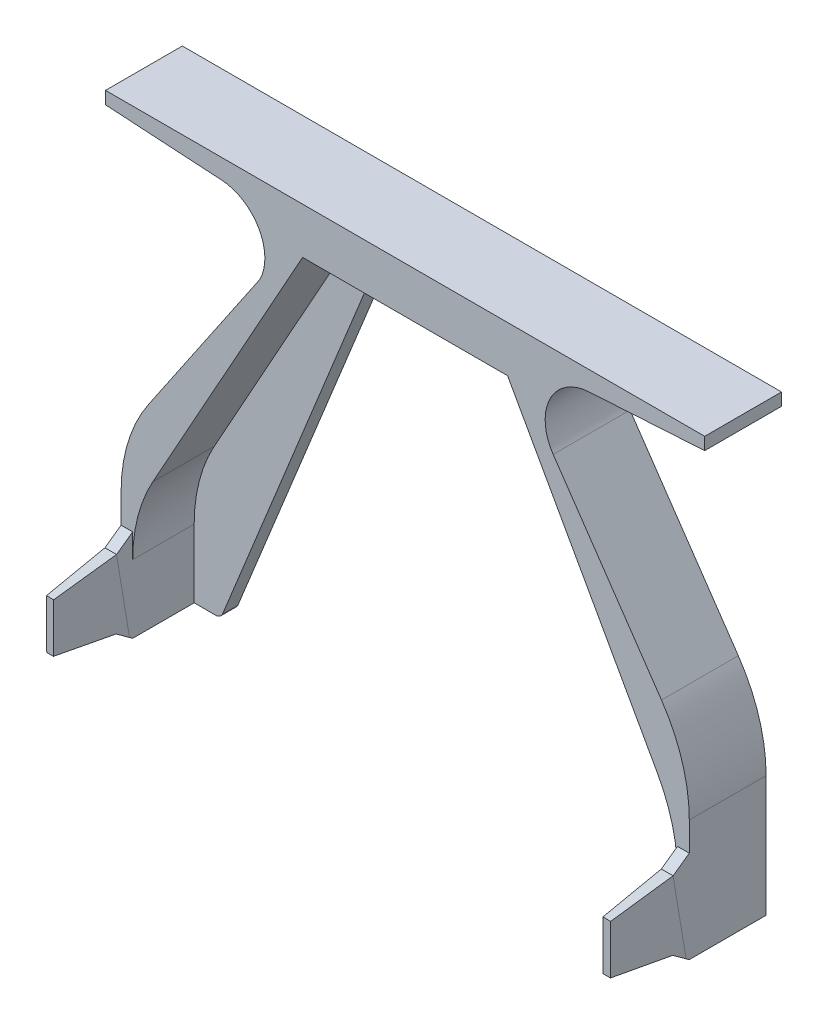
from build123d import *

# Parameters (mm, degrees)
SKETCH_1_W               = 47
SKETCH_1_H               = 32
EXTRUDE_1_DEPTH          = 5
CUT_EXTRUDE_1_DEPTH      = 58.078892771
CUT_EXTRUDE_5_DEPTH      = 4
CUT_EXTRUDE_6_DEPTH      = 58.078892771
SKETCH_5_W               = 0.757642216
SKETCH_5_H               = 6
SKETCH_5_W_2             = 0.766357784
EXTRUDE_2_DEPTH          = 5
CUT_EXTRUDE_7_DEPTH      = 54.728894948
CUT_EXTRUDE_8_DEPTH      = 55.418489547
SKETCH_8_W               = 47
SKETCH_8_H               = 2
CUT_EXTRUDE_9_DEPTH      = 10
CUT_EXTRUDE_START        = -0.814789408
CUT_EXTRUDE_10_OUTLINE_W = 4.001231447
CUT_EXTRUDE_10_OUTLINE_H = 5
CUT_EXTRUDE_10_DEPTH     = 0.814789408


# Read off the part's stored shape, not the designer's step: 切除-拉伸10
with BuildPart() as part:
    # 草图1 → 凸台-拉伸1 (new body)
    with BuildSketch(Plane.XY):
        with Locations((23.5, 16)):
            Rectangle(SKETCH_1_W, SKETCH_1_H)
    extrude(amount=EXTRUDE_1_DEPTH)

    # 草图2 → 切除-拉伸1 (cut, through all)
    with BuildSketch(Plane.XY.offset(5)):
        with BuildLine():
            Line((23.5, 0), (23.5, 26))
            Line((23.5, 26), (18.566996488, 26))
            ThreePointArc((18.566996488, 26), (18.15387041, 25.873934732), (17.881511675, 25.538694031))
            Line((17.881511675, 25.538694031), (7.626711155, 0.31171158))
            ThreePointArc((7.626711155, 0.31171158), (7.442674144, 0.085184252), (7.163518462, 0))
            Line((7.163518462, 0), (7.5, 0))
            Line((7.5, 0), (23.5, 0))
        make_face()
        with BuildLine():
            Line((28.45115486, 26), (23.5, 26))
            Line((23.5, 26), (23.5, 0))
            Line((23.5, 0), (39.5, 0))
            Line((39.5, 0), (39.836703186, 0))
            ThreePointArc((39.836703186, 0), (39.557420976, 0.085269428), (39.373395704, 0.311994211))
            Line((39.373395704, 0.311994211), (29.136809551, 25.538275761))
            ThreePointArc((29.136809551, 25.538275761), (28.864468188, 25.873808678), (28.45115486, 26))
        make_face()
    extrude(amount=-CUT_EXTRUDE_1_DEPTH, mode=Mode.SUBTRACT)

    # 草图3 → 切除-拉伸5 (cut)
    with BuildSketch(Plane.XY.offset(5)):
        with BuildLine():
            Line((28.45115486, 26), (18.566996488, 26))
            add(Edge.make_bspline(
                [(18.566996488, 26), (18.083486738, 25.978522449), (17.881511675, 25.538694031)],
                knots=[0, 0, 0, 1, 1, 1], degree=2))
            Line((17.881511675, 25.538694031), (7.614040039, 0.280540422))
            ThreePointArc((7.614040039, 0.280540422), (7.448406729, 0.076665827), (7.197166615, 0))
            Line((7.197166615, 0), (5.772, 0))
            Line((5.772, 0), (5.772, 4.436119664))
            ThreePointArc((5.772, 4.436119664), (6.104843669, 7.043618399), (7.082028835, 9.483893735))
            Line((7.082028835, 9.483893735), (16.830389156, 27))
            Line((16.830389156, 27), (30.169610844, 27))
            Line((30.169610844, 27), (39.917971165, 9.483893735))
            ThreePointArc((39.917971165, 9.483893735), (40.895156331, 7.043618399), (41.228, 4.436119664))
            Line((41.228, 4.436119664), (41.228, 0))
            Line((41.228, 0), (39.803032868, 0))
            ThreePointArc((39.803032868, 0), (39.551678879, 0.076742485), (39.386056133, 0.28079479))
            Line((39.386056133, 0.28079479), (29.136809551, 25.538275761))
            add(Edge.make_bspline(
                [(28.45115486, 26), (28.93495417, 25.978479476), (29.136809551, 25.538275761)],
                knots=[0, 0, 0, 1, 1, 1], degree=2))
        make_face()
    extrude(amount=-CUT_EXTRUDE_5_DEPTH, mode=Mode.SUBTRACT)

    # 草图4 → 切除-拉伸6 (cut, through all)
    with BuildSketch(Plane.XY.offset(5)):
        with BuildLine():
            Line((0, 0), (5.014357784, 0))
            Line((5.014357784, 0), (5.014357784, 7.877425761))
            ThreePointArc((5.014357784, 7.877425761), (5.475718856, 10.937654809), (6.818789734, 13.72584714))
            Line((6.818789734, 13.72584714), (14.045555305, 24.365213617))
            ThreePointArc((14.045555305, 24.365213617), (13.978253194, 27.216535436), (11.556446219, 28.722993754))
            Line((11.556446219, 28.722993754), (0, 29.43))
            Line((0, 29.43), (0, 0))
        make_face()
        with BuildLine():
            Line((41.994357784, 7.873314412), (41.994357784, 0))
            Line((41.994357784, 0), (47, 0))
            Line((47, 0), (47, 29.43))
            Line((47, 29.43), (35.433873083, 28.73462187))
            ThreePointArc((35.433873083, 28.73462187), (32.920113477, 27.060422918), (33.13664909, 24.047941912))
            Line((33.13664909, 24.047941912), (40.185693822, 13.727936391))
            ThreePointArc((40.185693822, 13.727936391), (41.531889434, 10.937130001), (41.994357784, 7.873314412))
        make_face()
    extrude(amount=-CUT_EXTRUDE_6_DEPTH, mode=Mode.SUBTRACT)

    # 草图5 → 凸台-拉伸2 (add)
    with BuildSketch(Plane.XY.offset(5)):
        with Locations((5.393178892, 3)):
            Rectangle(SKETCH_5_W, SKETCH_5_H)
        with Locations((41.611178892, 3)):
            Rectangle(SKETCH_5_W_2, SKETCH_5_H)
    extrude(amount=EXTRUDE_2_DEPTH)

    # 草图6 → 切除-拉伸7 (cut, through all)
    with BuildSketch(Plane.ZY.offset(-5.014357784)):
        Polygon((6.053573934, 5.25247322), (10, 4.6), (10, 6), (5, 6), align=None)
        Polygon((10, 0), (10, 1.4), (6.053573934, 0.757008468), (5, 0), align=None)
    extrude(amount=-CUT_EXTRUDE_7_DEPTH, mode=Mode.SUBTRACT)

    # 草图7 → 切除-拉伸8 (cut, through all)
    with BuildSketch(Plane(origin=(0, 6.086940952, 1.006370294), x_dir=(1, 0, 0), z_dir=(0, 0.9866065166041178, 0.16311830490257262))):
        Polygon((5.1771781, -9.637699539), (5.158383514, -9.115720963), (5.014357784, -9.115720963), (5.014357784, -9.637699539), align=None)
        Polygon((5.158383514, -9.115720963), (5.014357784, -5.115720963), (5.014357784, -9.115720963), align=None)
        Polygon((5.772, -9.115720963), (5.772, -5.115720963), (5.627806352, -9.115720963), align=None)
        Polygon((5.772, -9.115720963), (5.627806352, -9.115720963), (5.608989853, -9.637699539), (5.772, -9.637699539), align=None)
        Polygon((41.994357784, -9.637699539), (41.994357784, -5.115720963), (41.862646969, -9.637699539), align=None)
        Polygon((41.390820316, -9.637699539), (41.228, -5.115720963), (41.228, -9.637699539), align=None)
    extrude(amount=-CUT_EXTRUDE_8_DEPTH, mode=Mode.SUBTRACT)

    # 草图8 → 切除-拉伸9 (cut)
    with BuildSketch(Plane.XY.offset(5)):
        with Locations((23.5, 31)):
            Rectangle(SKETCH_8_W, SKETCH_8_H)
    extrude(amount=-CUT_EXTRUDE_9_DEPTH, mode=Mode.SUBTRACT)

    # 切除-拉伸10 outline → 切除-拉伸10 (cut)
    with BuildSketch(Plane(origin=(0, 30, 0), x_dir=(1, 0, 0), z_dir=(0, 1, 0)).offset(CUT_EXTRUDE_START)):
        with Locations((2.000615724, -2.5)):
            Rectangle(CUT_EXTRUDE_10_OUTLINE_W, CUT_EXTRUDE_10_OUTLINE_H)
        with Locations((44.999384277, -2.5)):
            Rectangle(CUT_EXTRUDE_10_OUTLINE_W, CUT_EXTRUDE_10_OUTLINE_H)
    extrude(amount=CUT_EXTRUDE_10_DEPTH, mode=Mode.SUBTRACT)


solid = part.part
